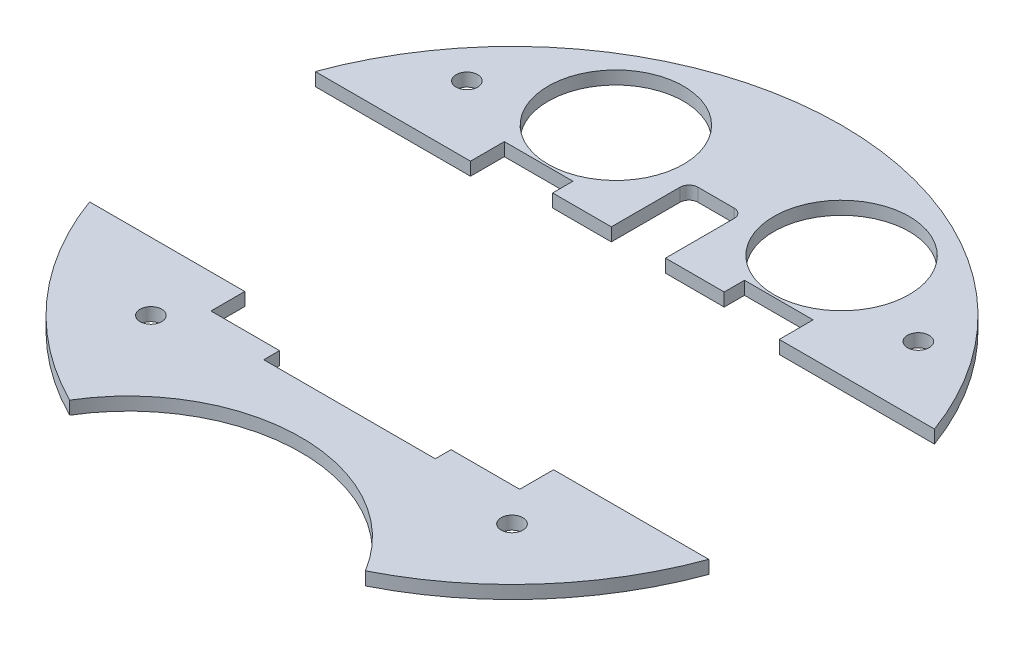
from build123d import *

# Parameters (mm, degrees)
BOSS_EXTRUDE1_DEPTH  = 2.9
SOLENOID_PLACEMENT_W = 38
SOLENOID_PLACEMENT_H = 64
CUT_EXTRUDE1_DEPTH   = 104.278313309
SKETCH7_R            = 15
CUT_EXTRUDE6_DEPTH   = 104.278313309
SKETCH8_R            = 2.4
CUT_EXTRUDE7_DEPTH   = 104.278313309
CUT_EXTRUDE3_DEPTH   = 104.278313309
CUT_EXTRUDE8_DEPTH   = 101.206836094


with BuildPart() as part:
    # Sketch1 → Boss-Extrude1 (new body)
    with BuildSketch(Plane(origin=(0, 0, 0), x_dir=(1, 0, 0), z_dir=(0, 1, 0))):
        with BuildLine():
            ThreePointArc((32.751135309, -65.240808824), (0, 73), (-32.751135309, -65.240808824))
            ThreePointArc((-32.751135309, -65.240808824), (0, -46.75), (32.751135309, -65.240808824))
        make_face()
    extrude(amount=BOSS_EXTRUDE1_DEPTH)

    # solenoid placement → Cut-Extrude1 (cut, through all)
    with BuildSketch(Plane(origin=(0, 2.9, 0), x_dir=(1, 0, 0), z_dir=(0, 1, 0))):
        with Locations((0, -4)):
            Rectangle(SOLENOID_PLACEMENT_W, SOLENOID_PLACEMENT_H)
    extrude(amount=-CUT_EXTRUDE1_DEPTH, mode=Mode.SUBTRACT)

    # Sketch7 → Cut-Extrude6 (cut, through all)
    with BuildSketch(Plane(origin=(0, 2.9, 0), x_dir=(1, 0, 0), z_dir=(0, 1, 0))):
        with Locations((25, 48)):
            Circle(SKETCH7_R)
        with Locations((-25, 48)):
            Circle(SKETCH7_R)
    extrude(amount=-CUT_EXTRUDE6_DEPTH, mode=Mode.SUBTRACT)

    # Sketch8 → Cut-Extrude7 (cut, through all)
    with BuildSketch(Plane(origin=(0, 2.9, 0), x_dir=(1, 0, 0), z_dir=(0, 1, 0))):
        with Locations((40, -40)):
            Circle(SKETCH8_R)
        with Locations((-40, -40)):
            Circle(SKETCH8_R)
        with Locations((-50, 40)):
            Circle(SKETCH8_R)
        with Locations((50, 40)):
            Circle(SKETCH8_R)
    extrude(amount=-CUT_EXTRUDE7_DEPTH, mode=Mode.SUBTRACT)

    # Sketch3 → Cut-Extrude3 (cut, through all)
    with BuildSketch(Plane(origin=(0, 2.9, 0), x_dir=(1, 0, 0), z_dir=(0, 1, 0))):
        with BuildLine():
            Line((-34.2, -32.5), (-22.2, -32.5))
            Line((-22.2, -32.5), (-19, -32.5))
            Line((-19, -32.5), (-19, 32.5))
            Line((-19, 32.5), (-22.2, 32.5))
            Line((-22.2, 32.5), (-34.2, 32.5))
            Line((-34.2, 32.5), (-34.2, 25))
            Line((-34.2, 25), (-68.585712798, 25))
            ThreePointArc((-68.585712798, 25), (-73, 0), (-68.585712798, -25))
            Line((-68.585712798, -25), (-34.2, -25))
            Line((-34.2, -25), (-34.2, -32.5))
        make_face()
        with BuildLine():
            Line((19, 32.5), (19, -32.5))
            Line((19, -32.5), (22.2, -32.5))
            Line((22.2, -32.5), (34.2, -32.5))
            Line((34.2, -32.5), (34.2, -25))
            Line((34.2, -25), (68.585712798, -25))
            ThreePointArc((68.585712798, -25), (73, 0), (68.585712798, 25))
            Line((68.585712798, 25), (34.2, 25))
            Line((34.2, 25), (34.2, 32.5))
            Line((34.2, 32.5), (22.2, 32.5))
            Line((22.2, 32.5), (19, 32.5))
        make_face()
    extrude(amount=-CUT_EXTRUDE3_DEPTH, mode=Mode.SUBTRACT)


with BuildPart() as cut_extrude3_piece_1:
    # of the separate pieces the step leaves, piece 1, a body of its own (cut_extrude3_pieces)
    add(part.part.solids().sort_by_distance((68.585712798, 0, -25))[0])

    # Sketch9 → Cut-Extrude8 (cut, through all)
    with BuildSketch(Plane(origin=(0, 2.9, 0), x_dir=(1, 0, 0), z_dir=(0, 1, 0))):
        with BuildLine():
            Line((6, 43.2), (6, 28))
            Line((6, 28), (-6, 28))
            Line((-6, 28), (-6, 43.2))
            ThreePointArc((-6, 43.2), (-5.414213562, 44.614213562), (-4, 45.2))
            Line((-4, 45.2), (4, 45.2))
            ThreePointArc((4, 45.2), (5.414213562, 44.614213562), (6, 43.2))
        make_face()
    extrude(amount=-CUT_EXTRUDE8_DEPTH, mode=Mode.SUBTRACT)


with BuildPart() as cut_extrude3_piece_2:
    # of the separate pieces the step leaves, piece 2, a body of its own (cut_extrude3_pieces)
    add(part.part.solids().sort_by_distance((-32.751135309, 0, 65.240808824))[0])


solid = Compound([cut_extrude3_piece_1.part, cut_extrude3_piece_2.part])
